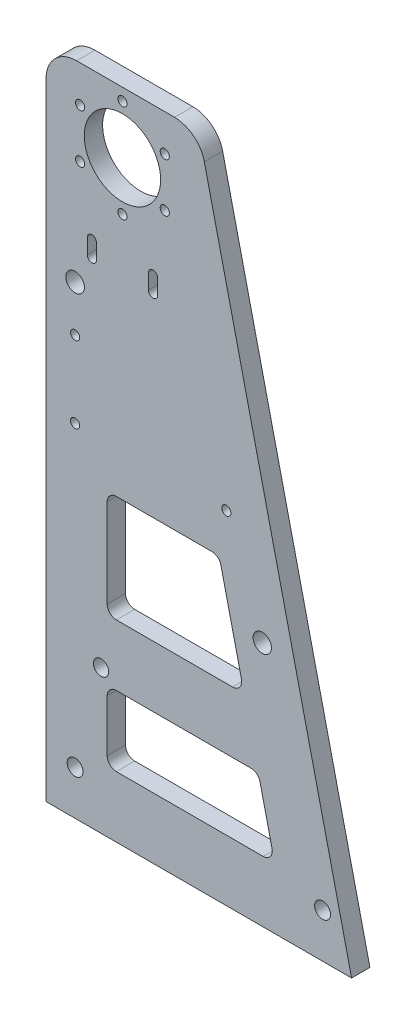
from build123d import *

# Parameters (mm, degrees)
ESBO_O1_R                = 12.5
ESBO_O1_R_2              = 1.5
ESBO_O1_R_3              = 2.5
RESSALTO_EXTRUS_O2_DEPTH = 6
FILETE1_R                = 10
ESBO_O2_R                = 1.5
ESBO_O2_R_2              = 2.6
ESBO_O2_R_3              = 3.05
CORTE_EXTRUS_O1_DEPTH    = 238.194013415
ESBO_O3_R                = 3
CORTE_EXTRUS_O2_DEPTH    = 238.194013415


with BuildPart() as part:
    # Esboço1 → Ressalto-extrusão2 (new body)
    with BuildSketch(Plane.XY):
        Polygon((0, 0), (0, 215), (50, 215), (100, 0), align=None)
        with Locations((25, 195)):
            Circle(ESBO_O1_R, mode=Mode.SUBTRACT)
        with Locations((25, 211)):
            Circle(ESBO_O1_R_2, mode=Mode.SUBTRACT)
        with Locations((38.856406461, 203)):
            Circle(ESBO_O1_R_2, mode=Mode.SUBTRACT)
        with Locations((38.856406461, 187)):
            Circle(ESBO_O1_R_2, mode=Mode.SUBTRACT)
        with Locations((25, 179)):
            Circle(ESBO_O1_R_2, mode=Mode.SUBTRACT)
        with Locations((11.143593539, 187)):
            Circle(ESBO_O1_R_2, mode=Mode.SUBTRACT)
        with Locations((11.143593539, 203)):
            Circle(ESBO_O1_R_2, mode=Mode.SUBTRACT)
        with Locations((18, 47)):
            Circle(ESBO_O1_R_3, mode=Mode.SUBTRACT)
        with BuildLine():
            Line((20, 95), (20, 66))
            ThreePointArc((20, 66), (20.878679656, 63.878679656), (23, 63))
            Line((23, 63), (61.03739436, 63))
            ThreePointArc((61.03739436, 63), (63.386715693, 64.134339454), (63.959418441, 66.679540484))
            Line((63.959418441, 66.679540484), (57.215232395, 95.679540484))
            ThreePointArc((57.215232395, 95.679540484), (56.15886886, 97.349321333), (54.293208314, 98))
            Line((54.293208314, 98), (23, 98))
            ThreePointArc((23, 98), (20.878679656, 97.121320344), (20, 95))
        make_face(mode=Mode.SUBTRACT)
        with BuildLine():
            Line((20, 40), (20, 23))
            ThreePointArc((20, 23), (20.878679656, 20.878679656), (23, 20))
            Line((23, 20), (71.03739436, 20))
            ThreePointArc((71.03739436, 20), (73.386715693, 21.134339454), (73.959418441, 23.679540484))
            Line((73.959418441, 23.679540484), (70.005930069, 40.679540484))
            ThreePointArc((70.005930069, 40.679540484), (68.949566534, 42.349321333), (67.083905988, 43))
            Line((67.083905988, 43), (23, 43))
            ThreePointArc((23, 43), (20.878679656, 42.121320344), (20, 40))
        make_face(mode=Mode.SUBTRACT)
    extrude(amount=RESSALTO_EXTRUS_O2_DEPTH)

    # Filete1
    filete1_edges = [part.edges().sort_by_distance(p)[0] for p in [
        (0, 215, 3),
        (50, 215, 3),
    ]]
    fillet(filete1_edges, radius=FILETE1_R)

    # Esboço2 → Corte-extrusão1 (cut, through all)
    with BuildSketch(Plane.XY.offset(6)):
        with Locations((9.5, 137)):
            Circle(ESBO_O2_R)
        with Locations((90.5, 14.5)):
            Circle(ESBO_O2_R_2)
        with Locations((9.5, 112)):
            Circle(ESBO_O2_R)
        with Locations((9.5, 152)):
            Circle(ESBO_O2_R_3)
        with Locations((59, 112)):
            Circle(ESBO_O2_R)
        with Locations((9.5, 14.5)):
            Circle(ESBO_O2_R_2)
        with BuildLine():
            Line((13.5, 161.71), (13.5, 166.71))
            ThreePointArc((13.5, 166.71), (15, 168.21), (16.5, 166.71))
            Line((16.5, 166.71), (16.5, 161.71))
            ThreePointArc((16.5, 161.71), (15, 160.21), (13.5, 161.71))
        make_face()
        with BuildLine():
            Line((33.5, 161.71), (33.5, 166.71))
            ThreePointArc((33.5, 166.71), (35, 168.21), (36.5, 166.71))
            Line((36.5, 166.71), (36.5, 161.71))
            ThreePointArc((36.5, 161.71), (35, 160.21), (33.5, 161.71))
        make_face()
    extrude(amount=-CORTE_EXTRUS_O1_DEPTH, mode=Mode.SUBTRACT)

    # Esboço3 → Corte-extrusão2 (cut, through all)
    with BuildSketch(Plane.XY.offset(6)):
        with Locations((70.759810426, 80.398555206)):
            Circle(ESBO_O3_R)
    extrude(amount=-CORTE_EXTRUS_O2_DEPTH, mode=Mode.SUBTRACT)


solid = part.part
